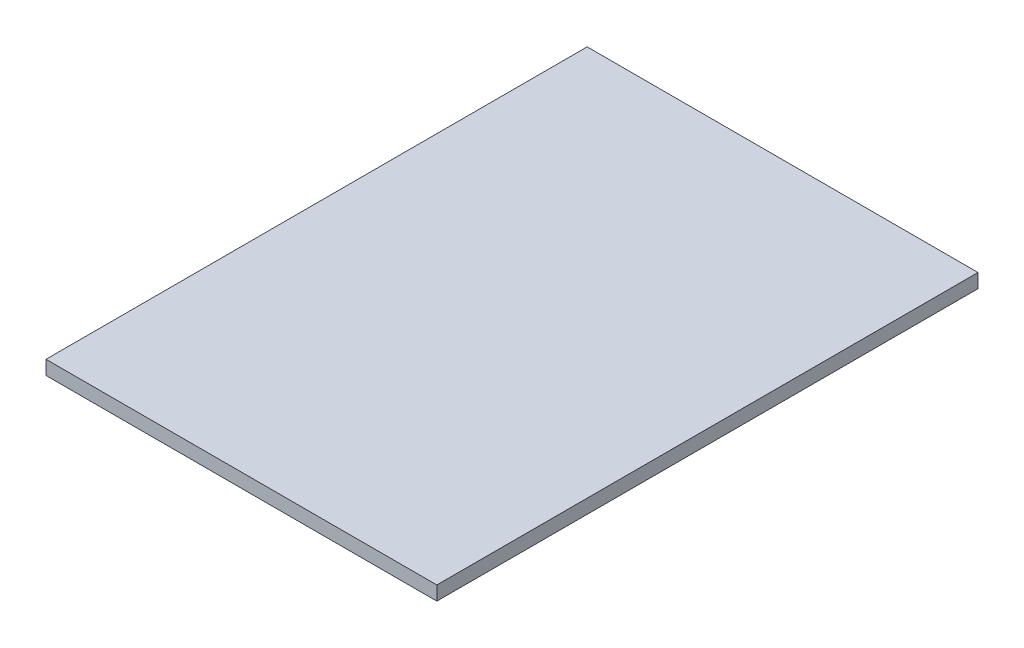
from build123d import *

# Parameters (mm, degrees)
SKETCH1_W           = 49.53
SKETCH1_H           = 68.58
BOSS_EXTRUDE1_DEPTH = 1.778


with BuildPart() as part:
    # Sketch1 → Boss-Extrude1 (new body)
    with BuildSketch(Plane(origin=(0, 0, 0), x_dir=(1, 0, 0), z_dir=(0, 1, 0))):
        Rectangle(SKETCH1_W, SKETCH1_H)
    extrude(amount=BOSS_EXTRUDE1_DEPTH)


solid = part.part
